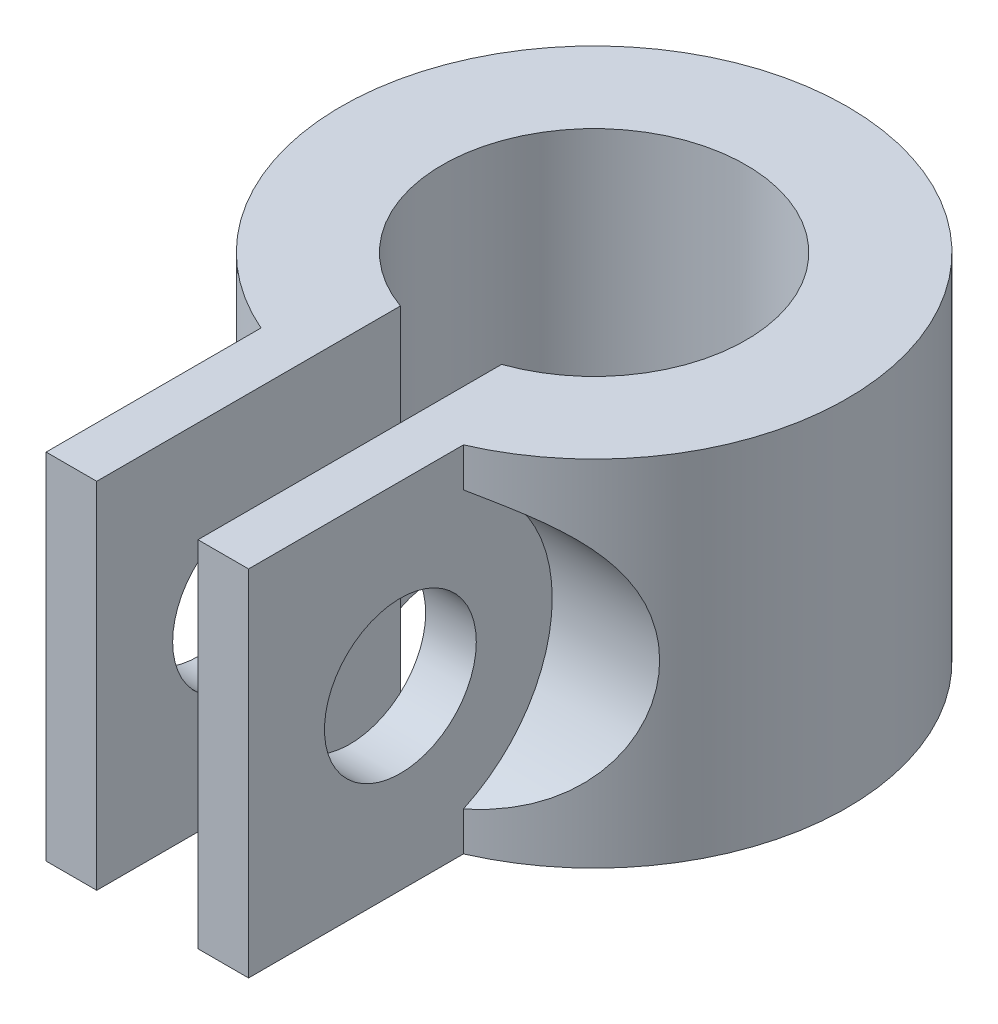
from build123d import *

# Parameters (mm, degrees)
SKETCH1_R               = 5
SKETCH1_R_2             = 3
BOSS_EXTRUDE1_DEPTH     = 7
SKETCH2_W               = 2
SKETCH2_H               = 5.830742268
CUT_EXTRUDE1_DEPTH      = 8
SKETCH3_W               = 6
SKETCH3_H               = 7
BOSS_EXTRUDE2_DEPTH     = 1
CUT_EXTRUDE2_DEPTH      = 13.764839423
CUT_EXTRUDE2_DEPTH_BACK = 13.764839423
SKETCH4_R               = 1.5
SKETCH5_R               = 3
CUT_EXTRUDE3_DEPTH      = 14.264280165


with BuildPart() as part:
    # Sketch1 → Boss-Extrude1 (new body)
    with BuildSketch(Plane(origin=(0, 0, 0), x_dir=(1, 0, 0), z_dir=(0, 1, 0))):
        Circle(SKETCH1_R)
        Circle(SKETCH1_R_2, mode=Mode.SUBTRACT)
    extrude(amount=BOSS_EXTRUDE1_DEPTH)

    # Sketch2 → Cut-Extrude1 (cut)
    with BuildSketch(Plane(origin=(0, 7, 0), x_dir=(1, 0, 0), z_dir=(0, 1, 0))):
        with Locations((0, -3.925683868)):
            Rectangle(SKETCH2_W, SKETCH2_H)
    extrude(amount=-CUT_EXTRUDE1_DEPTH, mode=Mode.SUBTRACT)

    # Sketch3 → Boss-Extrude2 (add)
    with BuildSketch(Plane(origin=(-1, 0, 0), x_dir=(0, 0, -1), z_dir=(1, 0, 0))):
        with Locations((-5.828427125, 3.5)):
            Rectangle(SKETCH3_W, SKETCH3_H)
    boss_extrude2 = extrude(amount=-BOSS_EXTRUDE2_DEPTH)

    # Mirror1: Boss-Extrude2 across plane
    add(boss_extrude2.mirror(Plane(origin=(0, 0, 0), x_dir=(0, 0, 1), z_dir=(1, 0, 0))))

    # Sketch4 → Cut-Extrude2 (cut, two sides: drawn at the far end of the back side and taken through both)
    with BuildSketch(Plane.ZY.offset(-1).offset(-CUT_EXTRUDE2_DEPTH_BACK)):
        with Locations((5.828427125, 3.5)):
            Circle(SKETCH4_R)
    extrude(amount=CUT_EXTRUDE2_DEPTH + CUT_EXTRUDE2_DEPTH_BACK, mode=Mode.SUBTRACT)

    # Sketch5 → Cut-Extrude3 (cut, through all)
    with BuildSketch(Plane.ZY.offset(2)):
        with Locations((5.828427125, 3.5)):
            Circle(SKETCH5_R)
    cut_extrude3 = extrude(amount=CUT_EXTRUDE3_DEPTH, mode=Mode.SUBTRACT)

    # Mirror2: Cut-Extrude3 across plane
    add(cut_extrude3.mirror(Plane(origin=(0, 0, 0), x_dir=(0, 0, 1), z_dir=(1, 0, 0))), mode=Mode.SUBTRACT)


solid = part.part
